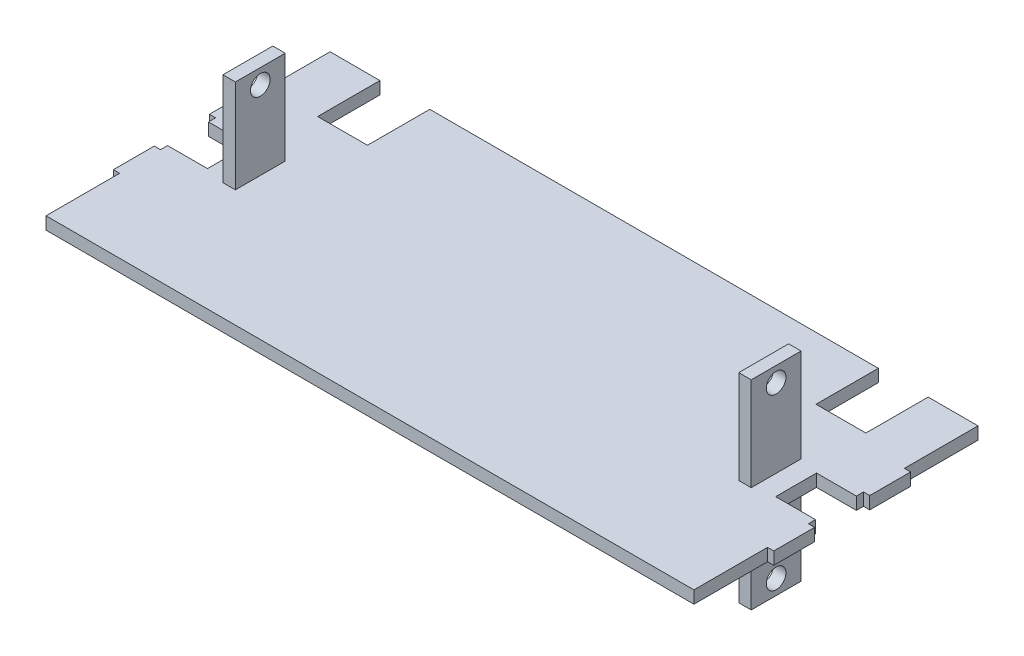
from build123d import *

# Parameters (mm, degrees)
BOSS_EXTRUDE1_DEPTH     = 3.175
SKETCH2_W               = 6.35
SKETCH2_H               = 25.4
BOSS_EXTRUDE2_DEPTH     = 50.8
CUT_EXTRUDE1_DEPTH      = 316.541333465
CUT_EXTRUDE1_DEPTH_BACK = 316.541333465
SKETCH3_R               = 5.0038


with BuildPart() as part:
    # Sketch1 → Boss-Extrude1 (new, symmetric)
    with BuildSketch(Plane(origin=(0, 0, 0), x_dir=(1, 0, 0), z_dir=(0, 1, 0))):
        Polygon((165.1, -72.39), (-165.1, -72.39), (-165.1, -34.874677354), (-168.275, -34.874677354), (-168.275, -14.046677354), (-165.1, -14.046677354), (-165.1, -10.414), (-144.78, -10.414), (-144.78, 10.414), (-165.1, 10.414), (-165.1, 14.046677354), (-168.275, 14.046677354), (-168.275, 34.874677354), (-165.1, 34.874677354), (-165.1, 72.39), (-139.7, 72.39), (-139.7, 40.64), (-114.3, 40.64), (-114.3, 72.39), (114.3, 72.39), (114.3, 40.64), (139.7, 40.64), (139.7, 72.39), (165.1, 72.39), (165.1, 34.874677354), (168.275, 34.874677354), (168.275, 14.046677354), (165.1, 14.046677354), (165.1, 10.414), (144.78, 10.414), (144.78, -10.414), (165.1, -10.414), (165.1, -14.046677354), (168.275, -14.046677354), (168.275, -34.874677354), (165.1, -34.874677354), align=None)
    extrude(amount=BOSS_EXTRUDE1_DEPTH, both=True)

    # Sketch2 → Boss-Extrude2 (add, symmetric)
    with BuildSketch(Plane(origin=(0, 0, 0), x_dir=(1, 0, 0), z_dir=(0, 1, 0))):
        with Locations((131.445, 0)):
            Rectangle(SKETCH2_W, SKETCH2_H)
        with Locations((-131.445, 0)):
            Rectangle(SKETCH2_W, SKETCH2_H)
    extrude(amount=BOSS_EXTRUDE2_DEPTH, both=True)

    # Sketch3 → Cut-Extrude1 (cut, two sides: drawn at the far end of the back side and taken through both)
    with BuildSketch(Plane.ZY.offset(134.62).offset(-CUT_EXTRUDE1_DEPTH_BACK)):
        with Locations((0, 43.18)):
            Circle(SKETCH3_R)
        with Locations((0, -43.18)):
            Circle(SKETCH3_R)
    extrude(amount=CUT_EXTRUDE1_DEPTH + CUT_EXTRUDE1_DEPTH_BACK, mode=Mode.SUBTRACT)


solid = part.part
